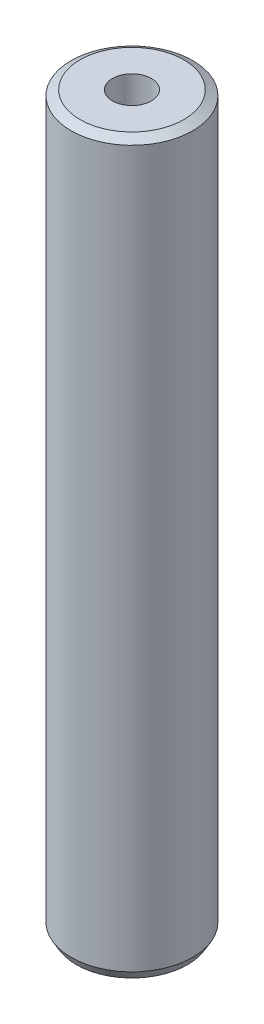
from build123d import *
from OCP.BRepFilletAPI import BRepFilletAPI_MakeChamfer

# Parameters (mm, degrees)
SKETCH1_R           = 50
BOSS_EXTRUDE1_DEPTH = 600
SKETCH2_R           = 16.010651598
CUT_EXTRUDE1_DEPTH  = 605.15229868
CHAMFER1_SIZE       = 4.257782824
CHAMFER1_SIZE2      = 7.374696178


with BuildPart() as part:
    # Sketch1 → Boss-Extrude1 (new body)
    with BuildSketch(Plane(origin=(0, 0, 0), x_dir=(1, 0, 0), z_dir=(0, 1, 0))):
        Circle(SKETCH1_R)
    extrude(amount=BOSS_EXTRUDE1_DEPTH)

    # Sketch2 → Cut-Extrude1 (cut, through all)
    with BuildSketch(Plane(origin=(0, 0, 0), x_dir=(1, 0, 0), z_dir=(0, 1, 0))):
        Circle(SKETCH2_R)
    extrude(amount=CUT_EXTRUDE1_DEPTH, mode=Mode.SUBTRACT)

    # Chamfer1: one chamfer whose edges measure the first distance from different faces: ONE call of the kernel's chamfer builder (chamfer() names one face for all edges)
    chamfer1_edges_1 = [part.edges().sort_by_distance(p)[0] for p in [
        (-50, 600, 0),
    ]]
    chamfer1_side_1 = [part.faces().sort_by_distance(p)[0] for p in [
        (-50, 300, 0),
    ]]
    chamfer1_edges_2 = [part.edges().sort_by_distance(p)[0] for p in [
        (-50, 0, 0),
    ]]
    chamfer1_side_2 = [part.faces().sort_by_distance(p)[0] for p in [
        (-48.585786438, 0, 0),
    ]]
    chamfer1 = BRepFilletAPI_MakeChamfer(part.part.solid().wrapped)
    for e in chamfer1_edges_1:
        chamfer1.Add(CHAMFER1_SIZE, CHAMFER1_SIZE2, e.wrapped, chamfer1_side_1[0].wrapped)  # the first distance lies on this face
    for e in chamfer1_edges_2:
        chamfer1.Add(CHAMFER1_SIZE, CHAMFER1_SIZE2, e.wrapped, chamfer1_side_2[0].wrapped)  # the first distance lies on this face
    add(Compound.cast(chamfer1.Shape()), mode=Mode.REPLACE)


solid = part.part
